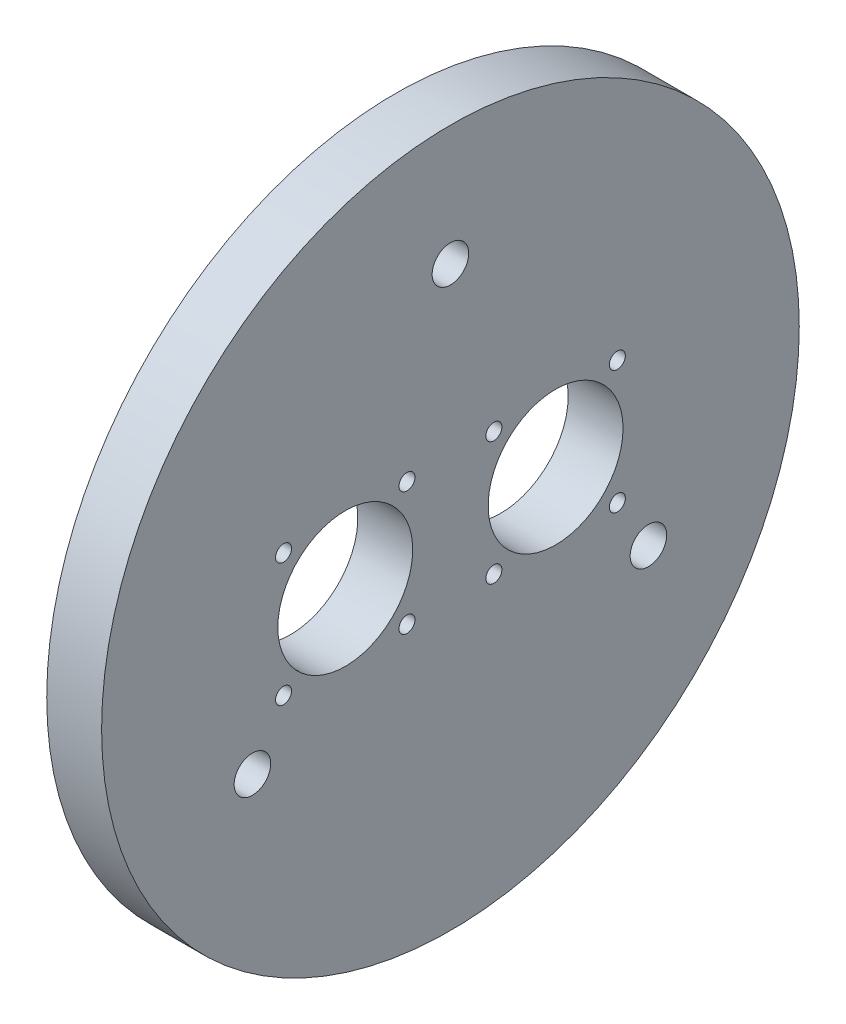
from build123d import *

# Parameters (mm, degrees)
SKETCH1_R           = 76.29
SKETCH1_R_2         = 4
SKETCH1_R_3         = 14.75
SKETCH1_R_4         = 1.75
BOSS_EXTRUDE1_DEPTH = 12


with BuildPart() as part:
    # Sketch1 → Boss-Extrude1 (new body)
    with BuildSketch(Plane(origin=(0, 0, 0), x_dir=(0, 0, -1), z_dir=(1, 0, 0))):
        Circle(SKETCH1_R)
        with Locations((0, 50)):
            Circle(SKETCH1_R_2, mode=Mode.SUBTRACT)
        with Locations((43.301270189, -25)):
            Circle(SKETCH1_R_2, mode=Mode.SUBTRACT)
        with Locations((-43.301270189, -25)):
            Circle(SKETCH1_R_2, mode=Mode.SUBTRACT)
        with Locations((23, 0)):
            Circle(SKETCH1_R_3, mode=Mode.SUBTRACT)
        with Locations((-23, 0)):
            Circle(SKETCH1_R_3, mode=Mode.SUBTRACT)
        with Locations((36.496900686, 13.496900686)):
            Circle(SKETCH1_R_4, mode=Mode.SUBTRACT)
        with Locations((36.496900686, -13.496900686)):
            Circle(SKETCH1_R_4, mode=Mode.SUBTRACT)
        with Locations((9.503099314, -13.496900686)):
            Circle(SKETCH1_R_4, mode=Mode.SUBTRACT)
        with Locations((9.503099314, 13.496900686)):
            Circle(SKETCH1_R_4, mode=Mode.SUBTRACT)
        with Locations((-36.496900686, -13.496900686)):
            Circle(SKETCH1_R_4, mode=Mode.SUBTRACT)
        with Locations((-9.503099314, -13.496900686)):
            Circle(SKETCH1_R_4, mode=Mode.SUBTRACT)
        with Locations((-9.503099314, 13.496900686)):
            Circle(SKETCH1_R_4, mode=Mode.SUBTRACT)
        with Locations((-36.496900686, 13.496900686)):
            Circle(SKETCH1_R_4, mode=Mode.SUBTRACT)
    extrude(amount=BOSS_EXTRUDE1_DEPTH)


solid = part.part
